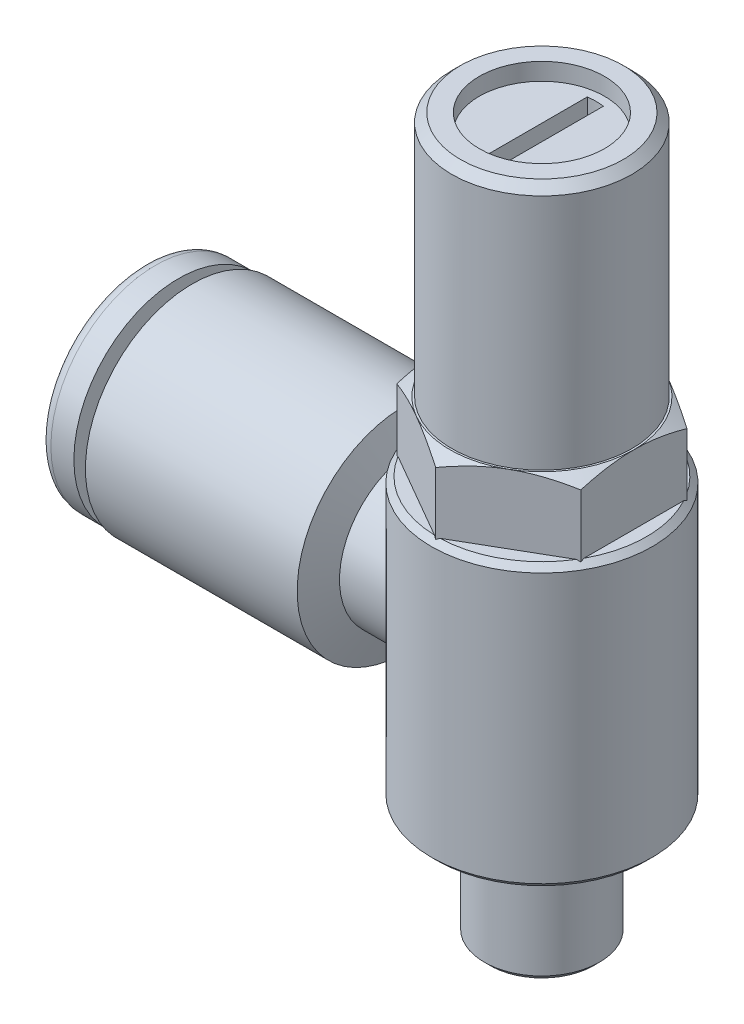
from build123d import *

# Parameters (mm, degrees)
BASE_BODY_DEPTH         = 5
BASE_BODY_DEPTH_BACK    = 7.2
BASE_BODY_SKETCH_R      = 4.8
RBODY_SML_SKETCH_R      = 3.3
RBODY_SML_DEPTH         = 5.5
HEX_2_DEPTH             = 3
THREAD_OFFSET_START     = -7.5
THREAD_OFFSET_SKETCH_R  = 3.5
THREAD_OFFSET_DEPTH     = 0.3
THREAD_SKETCH_W         = 2.5
THREAD_SKETCH_H         = 5.1
CHAMFER_2_SIZE          = 0.25
RBODY_SKETCH_R          = 4.65
RBODY_DEPTH             = 9.7
TUBE_SKETCH_R           = 2
TUBE_DEPTH              = 12.7
TUBE_RADIUS_R           = 0.5
DIAMETER_R              = 1
BODY_CHAMFER_SIZE       = 0.25
TAMPER_BODY_SKETCH_R    = 3.9166745
TAMPER_BODY_DEPTH       = 10.7
TAMPER_BODY_CHAM_SIZE   = 0.375
TAMPER_CONTROL_SKETCH_R = 2.725
TAMPER_CONTROL_DEPTH    = 0.75
TAMPER_FLAT_DEPTH       = 1.5


with BuildPart() as part:
    # Base-Body_Sketch → Base-Body (new, two sides: drawn at the far end of the back side and taken through both)
    with BuildSketch(Plane(origin=(0, 0, 0), x_dir=(1, 0, 0), z_dir=(0, 1, 0)).offset(-BASE_BODY_DEPTH_BACK)):
        with Locations(Location((0, 0, 0), (0, 0, 270))):
            Circle(BASE_BODY_SKETCH_R)
    extrude(amount=BASE_BODY_DEPTH + BASE_BODY_DEPTH_BACK)

    # RBody_sml_Sketch → RBody_sml (add)
    with BuildSketch(Plane(origin=(0, 0, 0), x_dir=(0, 0, -1), z_dir=(1, 0, 0))):
        Circle(RBODY_SML_SKETCH_R)
    extrude(amount=-RBODY_SML_DEPTH)

    # Hex_Sketch → Hex 2 (add)
    with BuildSketch(Plane(origin=(0, 5, 0), x_dir=(-1, 0, 0), z_dir=(0, 1, 0))):
        Polygon((4, 2.309401077), (0, 4.618802154), (-4, 2.309401077), (-4, -2.309401077), (0, -4.618802154), (4, -2.309401077), align=None)
    extrude(amount=HEX_2_DEPTH)

    # Hex_Chamfer_Sketch → Hex_Chamfer (revolve, cut)
    with BuildSketch(Plane(origin=(0, 0, 0), x_dir=(0, 0, -1), z_dir=(1, 0, 0))):
        Polygon((4, 8), (4.618802154, 8), (4.618802154, 7.64273441), align=None)
    revolve(axis=Axis((0, 0, 0), (0, 1, 0)), mode=Mode.SUBTRACT)

    # Thread_Offset_Sketch (on Top Plane) → Thread_Offset (add)
    with BuildSketch(Plane(origin=(0, 0, 0), x_dir=(1, 0, 0), z_dir=(0, 1, 0)).offset(THREAD_OFFSET_START)):
        with Locations(Location((0, 0, 0), (0, 0, 270))):
            Circle(THREAD_OFFSET_SKETCH_R)
    extrude(amount=THREAD_OFFSET_DEPTH)

    # Thread_Sketch → Thread (revolve)
    with BuildSketch(Plane.XY, mode=Mode.PRIVATE) as thread_sk:
        with Locations((-1.25, -9.75)):
            Rectangle(THREAD_SKETCH_W, THREAD_SKETCH_H)
    revolve(thread_sk.sketch.rotate(Axis((0, 0, 0), (0, -1, 0)), 270), axis=Axis((0, 0, 0), (0, -1, 0)))

    # Chamfer 2: size read off the stored shape
    # Chamfer 2
    chamfer_2_edges = [part.edges().sort_by_distance(p)[0] for p in [
        (0, -12.3, -2.5),
    ]]
    chamfer(chamfer_2_edges, length=CHAMFER_2_SIZE)

    # RBody_Sketch → RBody (add)
    with BuildSketch(Plane(origin=(-5.5, 0, 0), x_dir=(0, 0, -1), z_dir=(1, 0, 0))):
        Circle(RBODY_SKETCH_R)
    extrude(amount=-RBODY_DEPTH)

    # Release_Sketch → Release (revolve)
    with BuildSketch(Plane.XY, mode=Mode.PRIVATE) as release_sk:
        with BuildLine():
            Line((-17.3, 0), (-17.3, 4.05))
            ThreePointArc((-17.3, 4.05), (-17.153553391, 4.403553391), (-16.8, 4.55))
            Line((-16.8, 4.55), (-15.8, 4.55))
            Line((-15.8, 4.55), (-15.8, 2.5))
            Line((-15.8, 2.5), (-15.2, 2.5))
            Line((-15.2, 2.5), (-15.2, 0))
            Line((-15.2, 0), (-17.3, 0))
        make_face()
    revolve(release_sk.sketch.rotate(Axis((0, 0, 0), (-1, 0, 0)), 90), axis=Axis((0, 0, 0), (-1, 0, 0)))

    # Tube_Sketch → Tube (cut)
    with BuildSketch(Plane(origin=(-17.3, 0, 0), x_dir=(0, 0, -1), z_dir=(1, 0, 0))):
        Circle(TUBE_SKETCH_R)
    extrude(amount=TUBE_DEPTH, mode=Mode.SUBTRACT)

    # Tube_Radius
    tube_radius_edges = [part.edges().sort_by_distance(p)[0] for p in [
        (-17.3, 0, 2),
    ]]
    fillet(tube_radius_edges, radius=TUBE_RADIUS_R)

    # RBody_Chamfer: read off the stored shape, not the designer's step
    # RBody_Chamfer outline → RBody_Chamfer (revolve, cut)
    with BuildSketch(Plane.YX):
        Polygon((4.65, -5.5), (3.3, -5.5), (4.65, -5.991359816), align=None)
    revolve(axis=Axis((0, 0, 0), (1, 0, 0)), mode=Mode.SUBTRACT)

    # Port: sweep along a path in Profile
    with BuildLine(Plane.XY) as port_path:
        Line((-17.3, 0), (-2, 0))
        ThreePointArc((-2, 0), (-0.585786438, -0.585786438), (0, -2))
        Line((0, -2), (0, -12.3))
    # Diameter → Port (sweep, cut)
    with BuildSketch(Plane(origin=(0, -12.3, 0), x_dir=(-1, 0, 0), z_dir=(0, 1, 0))):
        Circle(DIAMETER_R)
    sweep(path=port_path.line, mode=Mode.SUBTRACT)

    # Body_Chamfer
    # the kernel refuses this chamfer: 0.25 mm, written as the material it takes off along each edge
    with BuildSketch(Plane(origin=(0, -7.2, 0), x_dir=(0, 0, 1), z_dir=(-1, 0, 0))) as body_chamfer_piece_1:
        Polygon((4.8, BODY_CHAMFER_SIZE), (4.8 - BODY_CHAMFER_SIZE, 0), (4.8, 0), align=None)
    revolve(axis=Axis((0, -7.2, 0), (0, 1, 0)), mode=Mode.SUBTRACT)
    with BuildSketch(Plane(origin=(0, 5, 0), x_dir=(0, 0, 1), z_dir=(-1, 0, 0))) as body_chamfer_piece_2_section:
        Polygon((4.8, -BODY_CHAMFER_SIZE), (4.8 - BODY_CHAMFER_SIZE, 0), (4.8, 0), align=None)
    body_chamfer_piece_2 = revolve(axis=Axis((0, 5, 0), (0, 1, 0)), mode=Mode.PRIVATE)
    body_chamfer_piece_2 = split(body_chamfer_piece_2, bisect_by=Plane(origin=(2, 5, 3.464101615), z_dir=(0.5000000000000002, 0, 0.8660254037844385)), keep=Keep.TOP, mode=Mode.PRIVATE)
    add(body_chamfer_piece_2, mode=Mode.SUBTRACT)
    with BuildSketch(Plane(origin=(0, 5, 0), x_dir=(0, 0, 1), z_dir=(-1, 0, 0))) as body_chamfer_piece_3_section:
        Polygon((4.8, -BODY_CHAMFER_SIZE), (4.8 - BODY_CHAMFER_SIZE, 0), (4.8, 0), align=None)
    body_chamfer_piece_3 = revolve(axis=Axis((0, 5, 0), (0, 1, 0)), mode=Mode.PRIVATE)
    body_chamfer_piece_3 = split(body_chamfer_piece_3, bisect_by=Plane(origin=(-2, 5, 3.464101615), z_dir=(-0.49999999999999983, 0, 0.8660254037844388)), keep=Keep.TOP, mode=Mode.PRIVATE)
    add(body_chamfer_piece_3, mode=Mode.SUBTRACT)
    with BuildSketch(Plane(origin=(0, 5, 0), x_dir=(0, 0, 1), z_dir=(-1, 0, 0))) as body_chamfer_piece_4_section:
        Polygon((4.8, -BODY_CHAMFER_SIZE), (4.8 - BODY_CHAMFER_SIZE, 0), (4.8, 0), align=None)
    body_chamfer_piece_4 = revolve(axis=Axis((0, 5, 0), (0, 1, 0)), mode=Mode.PRIVATE)
    body_chamfer_piece_4 = split(body_chamfer_piece_4, bisect_by=Plane(origin=(4, 5, 0), z_dir=(1, 0, 0)), keep=Keep.TOP, mode=Mode.PRIVATE)
    add(body_chamfer_piece_4, mode=Mode.SUBTRACT)
    with BuildSketch(Plane(origin=(0, 5, 0), x_dir=(0, 0, 1), z_dir=(-1, 0, 0))) as body_chamfer_piece_5_section:
        Polygon((4.8, -BODY_CHAMFER_SIZE), (4.8 - BODY_CHAMFER_SIZE, 0), (4.8, 0), align=None)
    body_chamfer_piece_5 = revolve(axis=Axis((0, 5, 0), (0, 1, 0)), mode=Mode.PRIVATE)
    body_chamfer_piece_5 = split(body_chamfer_piece_5, bisect_by=Plane(origin=(-4, 5, 0), z_dir=(-1, 0, 0)), keep=Keep.TOP, mode=Mode.PRIVATE)
    add(body_chamfer_piece_5, mode=Mode.SUBTRACT)
    with BuildSketch(Plane(origin=(0, 5, 0), x_dir=(0, 0, 1), z_dir=(-1, 0, 0))) as body_chamfer_piece_6_section:
        Polygon((4.8, -BODY_CHAMFER_SIZE), (4.8 - BODY_CHAMFER_SIZE, 0), (4.8, 0), align=None)
    body_chamfer_piece_6 = revolve(axis=Axis((0, 5, 0), (0, 1, 0)), mode=Mode.PRIVATE)
    body_chamfer_piece_6 = split(body_chamfer_piece_6, bisect_by=Plane(origin=(2, 5, -3.464101615), z_dir=(0.4999999999999999, 0, -0.8660254037844388)), keep=Keep.TOP, mode=Mode.PRIVATE)
    add(body_chamfer_piece_6, mode=Mode.SUBTRACT)
    with BuildSketch(Plane(origin=(0, 5, 0), x_dir=(0, 0, 1), z_dir=(-1, 0, 0))) as body_chamfer_piece_7_section:
        Polygon((4.8, -BODY_CHAMFER_SIZE), (4.8 - BODY_CHAMFER_SIZE, 0), (4.8, 0), align=None)
    body_chamfer_piece_7 = revolve(axis=Axis((0, 5, 0), (0, 1, 0)), mode=Mode.PRIVATE)
    body_chamfer_piece_7 = split(body_chamfer_piece_7, bisect_by=Plane(origin=(-2, 5, -3.464101615), z_dir=(-0.5, 0, -0.8660254037844387)), keep=Keep.TOP, mode=Mode.PRIVATE)
    add(body_chamfer_piece_7, mode=Mode.SUBTRACT)

    # Tamper Body_Sketch → Tamper Body (add)
    with BuildSketch(Plane(origin=(0, 8, 0), x_dir=(-1, 0, 0), z_dir=(0, 1, 0))):
        with Locations(Location((0, 0, 0), (0, 0, 270))):
            Circle(TAMPER_BODY_SKETCH_R)
    extrude(amount=TAMPER_BODY_DEPTH)

    # Tamper Body Cham
    tamper_body_cham_edges = [part.edges().sort_by_distance(p)[0] for p in [
        (0, 18.7, 3.9166745),
    ]]
    chamfer(tamper_body_cham_edges, length=TAMPER_BODY_CHAM_SIZE)

    # Tamper Control_Sketch → Tamper Control (cut)
    with BuildSketch(Plane(origin=(0, 18.7, 0), x_dir=(-1, 0, 0), z_dir=(0, 1, 0))):
        with Locations(Location((0, 0, 0), (0, 0, 90))):
            Circle(TAMPER_CONTROL_SKETCH_R)
    extrude(amount=-TAMPER_CONTROL_DEPTH, mode=Mode.SUBTRACT)

    # Tamper Flat_Sketch → Tamper Flat (cut)
    with BuildSketch(Plane(origin=(0, 17.95, 0), x_dir=(-1, 0, 0), z_dir=(0, 1, 0))):
        with BuildLine():
            Line((0.35, -2.323790008), (0.35, 2.323790008))
            ThreePointArc((0.35, 2.323790008), (0, 2.35), (-0.35, 2.323790008))
            Line((-0.35, 2.323790008), (-0.35, -2.323790008))
            ThreePointArc((-0.35, -2.323790008), (0, -2.35), (0.35, -2.323790008))
        make_face()
    extrude(amount=-TAMPER_FLAT_DEPTH, mode=Mode.SUBTRACT)


solid = part.part
